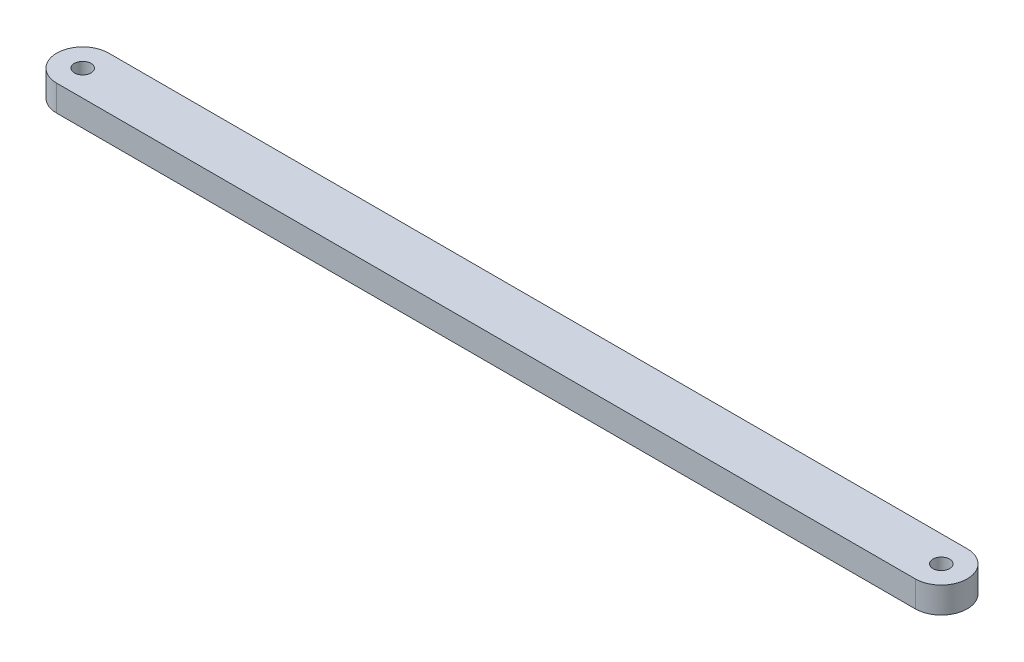
from build123d import *

# Parameters (mm, degrees)
SKETCH1_R           = 3.2
BOSS_EXTRUDE1_DEPTH = 10


with BuildPart() as part:
    # Sketch1 → Boss-Extrude1 (new body)
    with BuildSketch(Plane(origin=(0, 0, 0), x_dir=(1, 0, 0), z_dir=(0, 1, 0))):
        with BuildLine():
            Line((-165, 10), (165, 10))
            ThreePointArc((165, 10), (175, 0), (165, -10))
            Line((165, -10), (-165, -10))
            ThreePointArc((-165, -10), (-175, 0), (-165, 10))
        make_face()
        with Locations((-165, 0)):
            Circle(SKETCH1_R, mode=Mode.SUBTRACT)
        with Locations((165, 0)):
            Circle(SKETCH1_R, mode=Mode.SUBTRACT)
    extrude(amount=BOSS_EXTRUDE1_DEPTH)


solid = part.part
